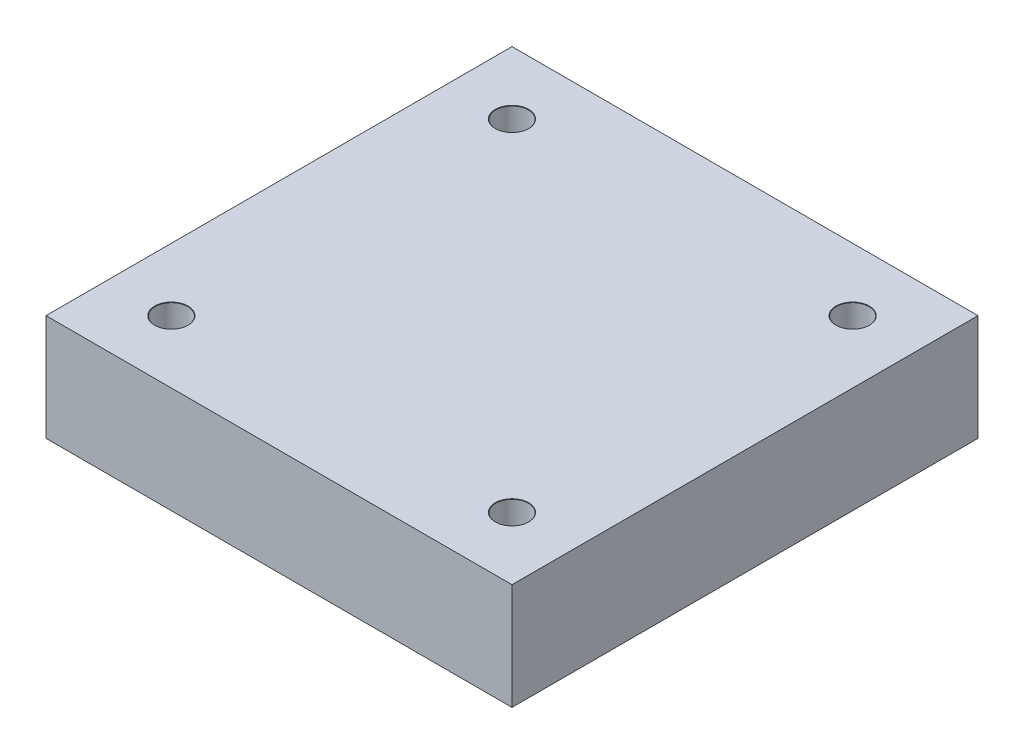
from build123d import *

# Parameters (mm, degrees)
SKETCH1_W                      = 34.2
SKETCH1_H                      = 34.2
BOSS_EXTRUDE1_DEPTH            = 3.9
M2_CLEARANCE_HOLE1_D           = 2.4
M2_CLEARANCE_HOLE1_CSINK_D     = 2.45
M2_CLEARANCE_HOLE1_CSINK_ANGLE = 90


with BuildPart() as part:
    # Sketch1 → Boss-Extrude1 (new, symmetric)
    with BuildSketch(Plane(origin=(0, 0, 0), x_dir=(1, 0, 0), z_dir=(0, 1, 0))):
        Rectangle(SKETCH1_W, SKETCH1_H)
    extrude(amount=BOSS_EXTRUDE1_DEPTH, both=True)

    # M2 Clearance Hole1 (through all)
    with Locations(Plane(origin=(0, 3.9, 0), x_dir=(1, 0, 0), z_dir=(0, 1, 0))):
        with Locations((-12.5, 12.5), (12.5, -12.5), (12.5, 12.5), (-12.5, -12.5)):
            CounterSinkHole(M2_CLEARANCE_HOLE1_D / 2, M2_CLEARANCE_HOLE1_CSINK_D / 2, counter_sink_angle=M2_CLEARANCE_HOLE1_CSINK_ANGLE)


solid = part.part
